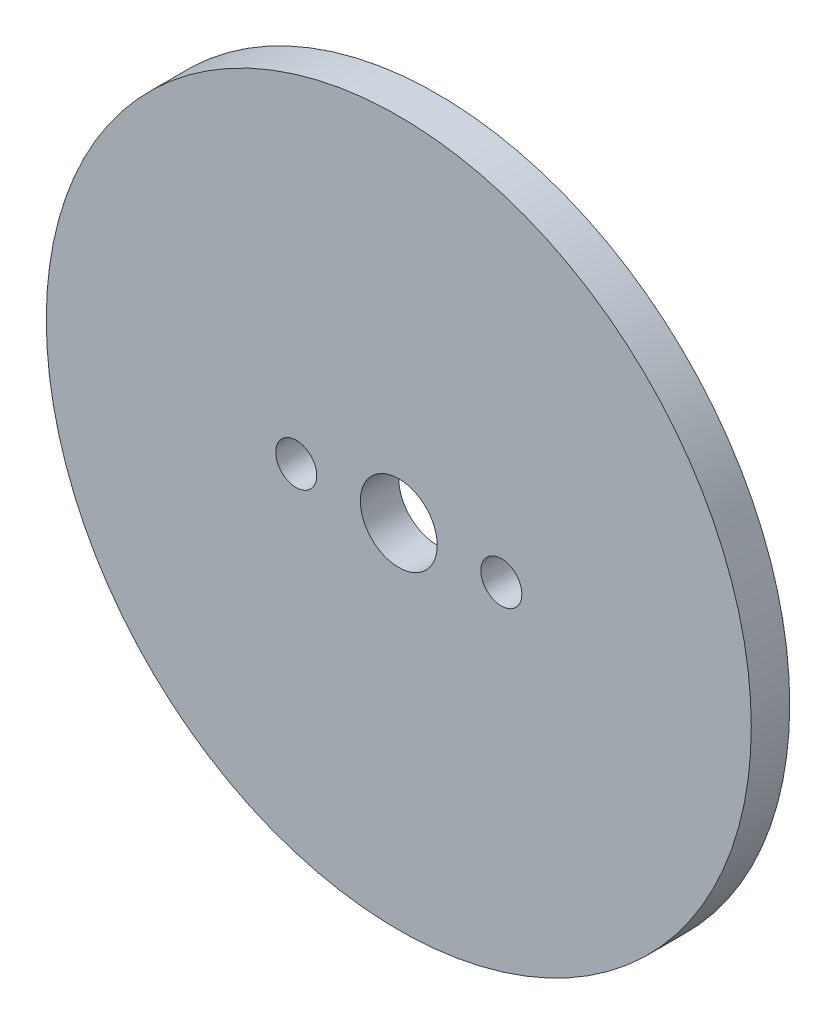
from build123d import *

# Parameters (mm, degrees)
ESBO_O1_R                = 27.5
ESBO_O1_R_2              = 3
ESBO_O1_R_3              = 1.6
RESSALTO_EXTRUS_O1_DEPTH = 1.5


with BuildPart() as part:
    # Esboço1 → Ressalto-extrusão1 (new, symmetric)
    with BuildSketch(Plane.XY):
        Circle(ESBO_O1_R)
        Circle(ESBO_O1_R_2, mode=Mode.SUBTRACT)
        with Locations((-8, 0)):
            Circle(ESBO_O1_R_3, mode=Mode.SUBTRACT)
        with Locations((8, 0)):
            Circle(ESBO_O1_R_3, mode=Mode.SUBTRACT)
    extrude(amount=RESSALTO_EXTRUS_O1_DEPTH, both=True)


solid = part.part
